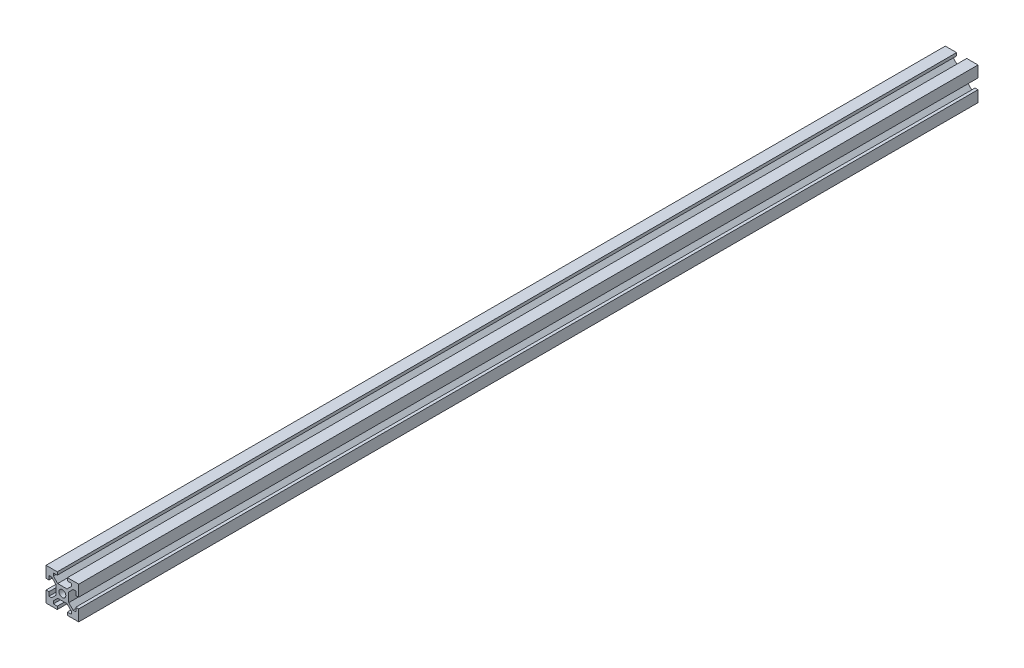
from build123d import *

# Parameters (mm, degrees)
BOSS_EXTRUDE1_DEPTH = 550
SKETCH2_R           = 2.1
CUT_EXTRUDE1_DEPTH  = 551.181788139
SKETCH3_R           = 2.1
CUT_EXTRUDE2_DEPTH  = 551.266506661


with BuildPart() as part:
    # Sketch1 → Boss-Extrude1 (new body)
    with BuildSketch(Plane.XY):
        Polygon((-3.1, 10), (-3.1, 8.200660172), (-5.5, 8.200660172), (-5.5, 6.560660172), (-2.84, 3.900660172), (2.84, 3.900660172), (5.5, 6.560660172), (5.5, 8.200660172), (3.1, 8.200660172), (3.1, 10), (10, 10), (10, 3.1), (8.200660172, 3.1), (8.200660172, 5.5), (6.560660172, 5.5), (3.900660172, 2.84), (3.900660172, -2.84), (6.560660172, -5.5), (8.200660172, -5.5), (8.200660172, -3.1), (10, -3.1), (10, -10), (3.1, -10), (3.1, -8.200660172), (5.5, -8.200660172), (5.5, -6.560660172), (2.84, -3.900660172), (-2.84, -3.900660172), (-5.5, -6.560660172), (-5.5, -8.200660172), (-3.1, -8.200660172), (-3.1, -10), (-10, -10), (-10, -3.1), (-8.200660172, -3.1), (-8.200660172, -5.5), (-6.560660172, -5.5), (-3.900660172, -2.84), (-3.900660172, 2.84), (-6.560660172, 5.5), (-8.200660172, 5.5), (-8.200660172, 3.1), (-10, 3.1), (-10, 10), align=None)
    extrude(amount=BOSS_EXTRUDE1_DEPTH)

    # Sketch2 → Cut-Extrude1 (cut, through all)
    with BuildSketch(Plane.XY.offset(550)):
        Circle(SKETCH2_R)
    extrude(amount=-CUT_EXTRUDE1_DEPTH, mode=Mode.SUBTRACT)

    # Sketch3 → Cut-Extrude2 (cut, through all)
    with BuildSketch(Plane(origin=(0, 3.900660172, 0), x_dir=(1, 0, 0), z_dir=(0, 1, 0))):
        with Locations((0, -275)):
            Circle(SKETCH3_R)
    extrude(amount=-CUT_EXTRUDE2_DEPTH, mode=Mode.SUBTRACT)


solid = part.part
